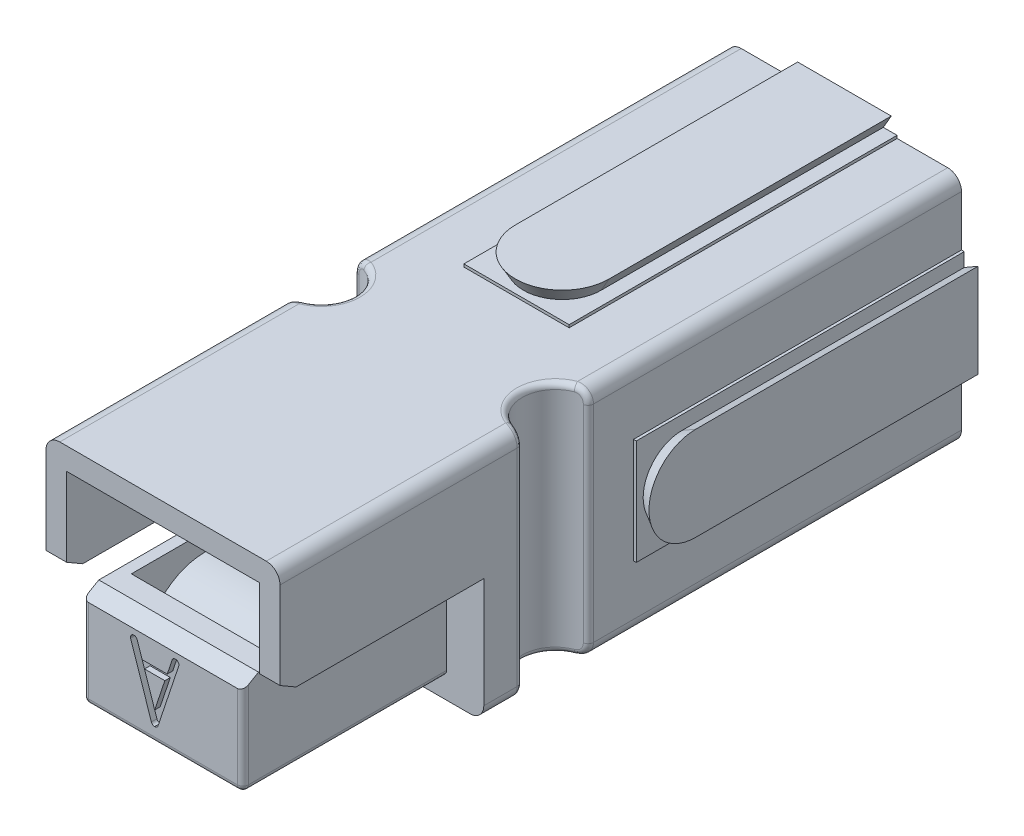
from build123d import *

# Parameters (mm, degrees)
EXTRUSION1_OUTLINE_W     = 8.5
EXTRUSION1_OUTLINE_H     = 8.5
EXTRUSION1_DEPTH         = 24.75
ENL_V_MAT_EXTRU_5_DEPTH  = 7.4
SKETCH2_W                = 7
SKETCH2_H                = 3.4
CUT_EXTRUDE12_DEPTH      = 8
ESQUISSE8_W              = 5.7
ESQUISSE8_H              = 5.7
ENL_V_MAT_EXTRU_7_DEPTH  = 10
CUT_EXTRUDE7_DEPTH       = 10.25
CUT_REVOLVE1_ANGLE       = 180
BOSS_EXTRUDE5_DEPTH      = 0.1
CUT_REVOLVE2_ANGLE       = 180
BOSS_EXTRUDE6_DEPTH      = 0.1
SKETCH16_W               = 3.82264973
SKETCH16_H               = 11.911324865
BOSS_EXTRUDE7_DEPTH      = 0.1
SKETCH17_W               = 11.911324865
SKETCH17_H               = 3.82264973
BOSS_EXTRUDE8_DEPTH      = 0.1
BOSS_EXTRUDE4_DEPTH      = 10.25
REVOLVE1_ANGLE           = 180
REVOLVE2_ANGLE           = 180
SKETCH13_W               = 5
SKETCH13_H               = 6.65
CUT_EXTRUDE16_DEPTH      = 2.5
EXTRUSION2_DEPTH         = 1.75
EXTRUSION2_DEPTH_BACK    = 1.75
SKETCH9_R                = 2
CUT_EXTRUDE9_DEPTH       = 6.75
CUT_EXTRUDE10_DEPTH      = 8.6
FILLET1_R                = 0.5
FILLET2_R                = 0.2
CUT_EXTRUDE11_DEPTH      = 4.5
CUT_EXTRUDE11_DEPTH_BACK = 4.5
CUT_EXTRUDE17_DEPTH      = 0.2
SCALE1_SCALE             = 0.956


# Read off the part's stored shape, not the designer's step: Extrusion1
with BuildPart() as part:
    # Extrusion1 outline → Extrusion1 (new body)
    with BuildSketch(Plane.XY):
        Rectangle(EXTRUSION1_OUTLINE_W, EXTRUSION1_OUTLINE_H)
    extrude(amount=EXTRUSION1_DEPTH)

    # Esquisse5 → Enlèv. mat.-Extru.5 (cut)
    with BuildSketch(Plane.XY.offset(24.75)):
        Polygon((-4.25, 0.25), (-4.25, -4.25), (4.25, -4.25), (4.25, 0.25), (2.9, 0.25), (2.9, -3.51), (0, -3.51), (-2.9, -3.51), (-2.9, 0.25), align=None)
    extrude(amount=-ENL_V_MAT_EXTRU_5_DEPTH, mode=Mode.SUBTRACT)

    # Sketch2 → Cut-Extrude12 (cut)
    with BuildSketch(Plane.XY.offset(17.35)):
        with Locations((0, 1.75)):
            Rectangle(SKETCH2_W, SKETCH2_H)
    extrude(amount=CUT_EXTRUDE12_DEPTH, mode=Mode.SUBTRACT)

    # Esquisse8 → Enlèv. mat.-Extru.7 (cut)
    with BuildSketch(Plane(origin=(0, 0, 0), x_dir=(-1, 0, 0), z_dir=(0, 0, -1))):
        Rectangle(ESQUISSE8_W, ESQUISSE8_H)
    extrude(amount=-ENL_V_MAT_EXTRU_7_DEPTH, mode=Mode.SUBTRACT)

    # Esquisse12 → Cut-Extrude7 (cut)
    with BuildSketch(Plane(origin=(0, 0, 0), x_dir=(-1, 0, 0), z_dir=(0, 0, -1))):
        Polygon((3.75, 1.7), (4.25, 1.411324865), (4.25, -1.411324865), (3.75, -1.7), align=None)
        Polygon((-1.411324865, -4.25), (1.411324865, -4.25), (1.7, -3.75), (-1.7, -3.75), align=None)
    extrude(amount=-CUT_EXTRUDE7_DEPTH, mode=Mode.SUBTRACT)

    # Sketch3 → Cut-Revolve1 (revolve, cut)
    with BuildSketch(Plane(origin=(0, 0, 10.25), x_dir=(-1, 0, 0), z_dir=(0, 0, -1))):
        Polygon((3.75, 0), (3.75, -1.7), (4.25, -1.411324865), (4.25, 0), align=None)
    revolve(axis=Axis((-3.75, 0, 10.25), (-1, 0, 0)), revolution_arc=CUT_REVOLVE1_ANGLE, mode=Mode.SUBTRACT)

    # Sketch14 → Boss-Extrude5 (add)
    with BuildSketch(Plane.ZY.offset(4.25)):
        with BuildLine():
            Line((0, 1.411324865), (10.25, 1.411324865))
            ThreePointArc((10.25, 1.411324865), (11.661324865, 0), (10.25, -1.411324865))
            Line((10.25, -1.411324865), (0, -1.411324865))
            Line((0, -1.411324865), (0, -1.911324865))
            Line((0, -1.911324865), (11.911324865, -1.911324865))
            Line((11.911324865, -1.911324865), (11.911324865, 1.911324865))
            Line((11.911324865, 1.911324865), (0, 1.911324865))
            Line((0, 1.911324865), (0, 1.411324865))
        make_face()
    extrude(amount=BOSS_EXTRUDE5_DEPTH)

    # Sketch4 → Cut-Revolve2 (revolve, cut)
    with BuildSketch(Plane(origin=(0, 0, 10.25), x_dir=(-1, 0, 0), z_dir=(0, 0, -1))):
        Polygon((0, -3.75), (1.7, -3.75), (1.411324865, -4.25), (0, -4.25), align=None)
    revolve(axis=Axis((0, -3.75, 10.25), (0, 1, 0)), revolution_arc=CUT_REVOLVE2_ANGLE, mode=Mode.SUBTRACT)

    # Sketch15 → Boss-Extrude6 (add)
    with BuildSketch(Plane.XZ.offset(4.25)):
        with BuildLine():
            Line((-1.411324865, 0), (-1.411324865, 10.25))
            ThreePointArc((-1.411324865, 10.25), (0, 11.661324865), (1.411324865, 10.25))
            Line((1.411324865, 10.25), (1.411324865, 0))
            Line((1.411324865, 0), (1.911324865, 0))
            Line((1.911324865, 0), (1.911324865, 11.911324865))
            Line((1.911324865, 11.911324865), (-1.911324865, 11.911324865))
            Line((-1.911324865, 11.911324865), (-1.911324865, 0))
            Line((-1.911324865, 0), (-1.411324865, 0))
        make_face()
    extrude(amount=BOSS_EXTRUDE6_DEPTH)

    # Sketch16 → Boss-Extrude7 (add)
    with BuildSketch(Plane(origin=(0, 4.25, 0), x_dir=(-1, 0, 0), z_dir=(0, 1, 0))):
        with Locations((0, 5.955662433)):
            Rectangle(SKETCH16_W, SKETCH16_H)
    extrude(amount=BOSS_EXTRUDE7_DEPTH)

    # Sketch17 → Boss-Extrude8 (add)
    with BuildSketch(Plane(origin=(4.25, 0, 0), x_dir=(0, 0, -1), z_dir=(1, 0, 0))):
        with Locations((-5.955662433, 0)):
            Rectangle(SKETCH17_W, SKETCH17_H)
    extrude(amount=BOSS_EXTRUDE8_DEPTH)

    # Sketch5 → Boss-Extrude4 (add)
    with BuildSketch(Plane(origin=(0, 0, 0), x_dir=(-1, 0, 0), z_dir=(0, 0, -1))):
        Polygon((1.411324865, 4.35), (-1.411324865, 4.35), (-1.7, 4.85), (1.7, 4.85), align=None)
        Polygon((-4.85, -1.7), (-4.85, 1.7), (-4.35, 1.411324865), (-4.35, -1.411324865), align=None)
    extrude(amount=-BOSS_EXTRUDE4_DEPTH)

    # Sketch6 → Revolve1 (revolve)
    with BuildSketch(Plane.XY.offset(10.25)):
        Polygon((0, 4.35), (1.411324865, 4.35), (1.7, 4.85), (0, 4.85), align=None)
    revolve(axis=Axis((0, 4.85, 10.25), (0, -1, 0)), revolution_arc=REVOLVE1_ANGLE)

    # Sketch7 → Revolve2 (revolve)
    with BuildSketch(Plane.XY.offset(10.25)):
        Polygon((4.85, -1.7), (4.85, 0), (4.35, 0), (4.35, -1.411324865), align=None)
    revolve(axis=Axis((4.85, 0, 10.25), (-1, 0, 0)), revolution_arc=REVOLVE2_ANGLE)

    # Sketch13 → Cut-Extrude16 (cut)
    with BuildSketch(Plane(origin=(0, 0.05, 0), x_dir=(-1, 0, 0), z_dir=(0, 1, 0))):
        with Locations((0, 20.075)):
            Rectangle(SKETCH13_W, SKETCH13_H)
    extrude(amount=-CUT_EXTRUDE16_DEPTH, mode=Mode.SUBTRACT)

    # Esquisse13 → Extrusion2 (add, two sides: drawn at the far end of the back side and taken through both)
    with BuildSketch(Plane(origin=(0, 0, 0), x_dir=(0, 0, -1), z_dir=(1, 0, 0)).offset(-EXTRUSION2_DEPTH_BACK)):
        with BuildLine():
            Line((-20.021850609, -0.403595516), (-16.75, -1.320909339))
            Line((-16.75, -1.320909339), (-16.75, -1.632477036))
            Line((-16.75, -1.632477036), (-20.171808548, -0.67312019))
            ThreePointArc((-20.171808548, -0.67312019), (-21.988556787, -0.221962307), (-23.305541831, -1.552250996))
            Line((-23.305541831, -1.552250996), (-23.595190502, -1.474125154))
            ThreePointArc((-23.595190502, -1.474125154), (-22.106613177, 0.05614832), (-20.021850609, -0.403595516))
        make_face()
    extrude(amount=EXTRUSION2_DEPTH + EXTRUSION2_DEPTH_BACK)

    # Sketch9 → Cut-Extrude9 (cut)
    with BuildSketch(Plane(origin=(0, 0, 10), x_dir=(-1, 0, 0), z_dir=(0, 0, -1))):
        Circle(SKETCH9_R)
    extrude(amount=-CUT_EXTRUDE9_DEPTH, mode=Mode.SUBTRACT)

    # Sketch10 → Cut-Extrude10 (cut)
    with BuildSketch(Plane(origin=(0, 4.25, 0), x_dir=(-1, 0, 0), z_dir=(0, 1, 0))):
        with BuildLine():
            Line((4.25, 13.55), (4.25, 15.95))
            ThreePointArc((4.25, 15.95), (3.05, 14.75), (4.25, 13.55))
        make_face()
        with BuildLine():
            Line((-4.25, 13.55), (-4.25, 15.95))
            ThreePointArc((-4.25, 15.95), (-3.05, 14.75), (-4.25, 13.55))
        make_face()
    extrude(amount=-CUT_EXTRUDE10_DEPTH, mode=Mode.SUBTRACT)

    # Fillet1
    fillet1_edges = [part.edges().sort_by_distance(p)[0] for p in [
        (-4.25, -4.25, 16.65),
        (-4.25, -4.25, 6.775),
        (4.25, -4.25, 16.65),
        (4.25, -4.25, 6.775),
        (-4.25, 4.25, 20.35),
        (-4.25, 4.25, 6.775),
        (4.25, 4.25, 6.775),
        (4.25, 4.25, 20.35),
    ]]
    fillet(fillet1_edges, radius=FILLET1_R)

    # Fillet2
    fillet2_edges = [part.edges().sort_by_distance(p)[0] for p in [
        (-2.9, -3.51, 21.05),
        (2.9, -3.51, 21.05),
        (-2.9, -1.73, 24.75),
        (0, -3.51, 24.75),
        (-3.05, -4.25, 14.75),
        (3.05, -4.25, 14.75),
        (-4.25, 0, 15.95),
        (-3.05, 4.25, 14.75),
        (-4.25, 0, 13.55),
        (-4.098419967, 4.108613337, 13.559612042),
        (-4.098419967, 4.108613337, 15.940387958),
        (-4.098419967, -4.108613337, 13.559612042),
        (-4.098419967, -4.108613337, 15.940387958),
        (4.25, 0, 15.95),
        (4.25, 0, 13.55),
        (3.05, 4.25, 14.75),
        (4.098419968, 4.108613336, 15.940387958),
        (4.098419968, 4.108613336, 13.559612042),
        (4.098419968, -4.108613336, 13.559612042),
        (4.098419968, -4.108613336, 15.940387958),
        (2.9, -1.73, 24.75),
    ]]
    fillet(fillet2_edges, radius=FILLET2_R)

    # Sketch11 → Cut-Extrude11 (cut, two sides: drawn at the far end of the back side and taken through both)
    with BuildSketch(Plane(origin=(0, 0, 0), x_dir=(0, 0, -1), z_dir=(1, 0, 0)).offset(-CUT_EXTRUDE11_DEPTH_BACK)):
        Polygon((-24.75, 0.587787058), (-24.75, 0.154774356), (-24.75, -0.278238346), (-24, 0.154774356), align=None)
    extrude(amount=CUT_EXTRUDE11_DEPTH + CUT_EXTRUDE11_DEPTH_BACK, mode=Mode.SUBTRACT)

    # Sketch18 → Cut-Extrude17 (cut)
    with BuildSketch(Plane.XY.offset(24.75)):
        with BuildLine():
            add(Edge.make_bspline(
                [(-0.938724046, -0.563528277), (-0.944191724, -0.551624048), (-0.954636495, -0.528883696), (-0.981106752, -0.50166242), (-1.015652341, -0.484972709), (-1.041290488, -0.481884271), (-1.054683895, -0.480270866)],
                knots=[0, 0, 0, 0, 1.030204786, 1.967974398, 2.938466691, 4, 4, 4, 4], degree=3))
            add(Edge.make_bspline(
                [(-1.054683895, -0.480270866), (-1.063349062, -0.481046677), (-1.080242864, -0.482559217), (-1.104762507, -0.48884847), (-1.126158906, -0.501075545), (-1.145241402, -0.516348404), (-1.160928732, -0.534941244), (-1.172331782, -0.556433158), (-1.179752737, -0.580064512), (-1.18071603, -0.596746257), (-1.181208286, -0.605270866)],
                knots=[0, 0, 0, 0, 1.056706776, 2.060178993, 3.045553801, 4.025758264, 5.019051294, 5.976528354, 6.965977191, 8, 8, 8, 8], degree=3))
            add(Edge.make_bspline(
                [(-1.181208286, -0.605270866), (-1.180772862, -0.611545292), (-1.179959166, -0.62327059), (-1.178383754, -0.634917439), (-1.177651375, -0.640331842)],
                knots=[0, 0, 0, 0, 1.070237272, 2, 2, 2, 2], degree=3))
            Line((-1.177651375, -0.640331842), (-0.422423193, -2.892666064))
            add(Edge.make_bspline(
                [(-0.422423193, -2.892666064), (-0.416980421, -2.905407343), (-0.406559594, -2.929802019), (-0.378619073, -2.958036272), (-0.34318481, -2.975784086), (-0.316920666, -2.978728259), (-0.303159505, -2.980270866)],
                knots=[0, 0, 0, 0, 1.046023809, 2.002735461, 2.953528535, 4, 4, 4, 4], degree=3))
            add(Edge.make_bspline(
                [(-0.303159505, -2.980270866), (-0.288705278, -2.978395566), (-0.26139994, -2.974852956), (-0.225084646, -2.956637759), (-0.196382931, -2.92915125), (-0.185703322, -2.905221586), (-0.180192025, -2.892872492)],
                knots=[0, 0, 0, 0, 1.085971307, 2.051497763, 2.994459901, 4, 4, 4, 4], degree=3))
            Line((-0.180192025, -2.892872492), (0.571543755, -0.639848026))
            add(Edge.make_bspline(
                [(0.571543755, -0.639848026), (0.573407526, -0.634638878), (0.577405925, -0.62346355), (0.578084118, -0.611602912), (0.578446186, -0.605270866)],
                knots=[0, 0, 0, 0, 0.932258736, 2, 2, 2, 2], degree=3))
            add(Edge.make_bspline(
                [(0.578446186, -0.605270866), (0.577739781, -0.596751113), (0.57635889, -0.58009657), (0.569094196, -0.556429724), (0.557649662, -0.534941594), (0.541972963, -0.51635063), (0.522890322, -0.501066439), (0.501626662, -0.488964504), (0.47733347, -0.482487569), (0.460592154, -0.481027196), (0.451921796, -0.480270866)],
                knots=[0, 0, 0, 0, 1.038553346, 2.030179789, 2.989764092, 3.985243189, 4.967604913, 5.955148361, 6.940967594, 8, 8, 8, 8], degree=3))
            add(Edge.make_bspline(
                [(0.451921796, -0.480270866), (0.438167351, -0.481843151), (0.411990839, -0.484835416), (0.376853215, -0.501957732), (0.348748985, -0.528411746), (0.338049625, -0.551600706), (0.332511227, -0.563604199)],
                knots=[0, 0, 0, 0, 1.068215676, 2.032954511, 2.981782019, 4, 4, 4, 4], degree=3))
            Line((0.332511227, -0.563604199), (0.153585922, -1.101205329))
            Line((0.153585922, -1.101205329), (-0.756087009, -1.101205329))
            Line((-0.756087009, -1.101205329), (-0.938724046, -0.563528277))
        make_face()
        Polygon((-0.671792992, -1.351205825), (0.065779654, -1.351205825), (-0.303006669, -2.458254542), align=None, mode=Mode.SUBTRACT)
    extrude(amount=-CUT_EXTRUDE17_DEPTH, mode=Mode.SUBTRACT)


with BuildPart() as part_1:
    # Scale1: scaled about (0.171696158, 0.261373201, 11.342083707)
    add(part.part.scale(SCALE1_SCALE).moved(Location((0.007554631, 0.011500421, 0.499051683))))


solid = part_1.part
